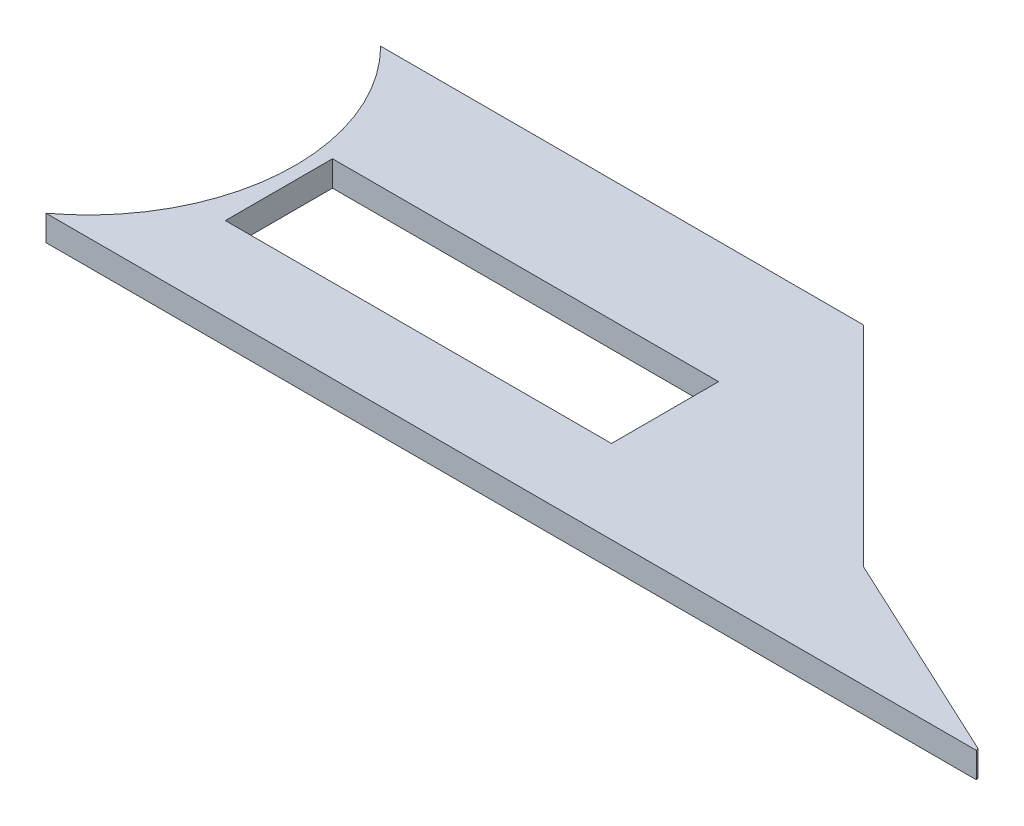
from build123d import *

# Parameters (mm, degrees)
EXTRUDE_1_DEPTH          = 2
CUT_EXTRUDE_1_DEPTH      = 106.5
CUT_EXTRUDE_1_DEPTH_BACK = 62.743635726


with BuildPart() as part:
    # Эскиз1 → Бобышка-Вытянуть1 (new body)
    with BuildSketch(Plane(origin=(0, 0, 0), x_dir=(1, 0, 0), z_dir=(0, 1, 0))):
        with BuildLine():
            Line((-56.923759365, -23.831956958), (16.382902061, -23.831956958))
            Line((16.382902061, -23.831956958), (-0.836945892, -15.802209985))
            Line((-0.836945892, -15.802209985), (-17.271974735, 0.632818857))
            Line((-17.271974735, 0.632818857), (-55.146365247, 0.632818857))
            ThreePointArc((-55.146365247, 0.632818857), (-50.679018006, -7.808361393), (-51.74094673, -17.29956905))
            ThreePointArc((-51.74094673, -17.29956905), (-53.905020217, -20.904809923), (-56.923759365, -23.831956958))
        make_face()
        Polygon((-19.117097939, -17.29956905), (-49.391279562, -17.29956905), (-49.391279562, -8.89956905), (-27.396659044, -8.89956905), (-19.117097939, -8.89956905), align=None, mode=Mode.SUBTRACT)
    extrude(amount=EXTRUDE_1_DEPTH)

    # Эскиз2 → Вырез-Вытянуть1 (cut, two sides: drawn at the far end of the back side and taken through both)
    with BuildSketch(Plane(origin=(0, 2, 0), x_dir=(1, 0, 0), z_dir=(0, 1, 0)).offset(-CUT_EXTRUDE_1_DEPTH_BACK)):
        Polygon((16.382902061, -23.831956958), (15.960145161, -23.634822178), (16.059019052, -23.90647596), align=None)
    extrude(amount=CUT_EXTRUDE_1_DEPTH + CUT_EXTRUDE_1_DEPTH_BACK, mode=Mode.SUBTRACT)


solid = part.part
